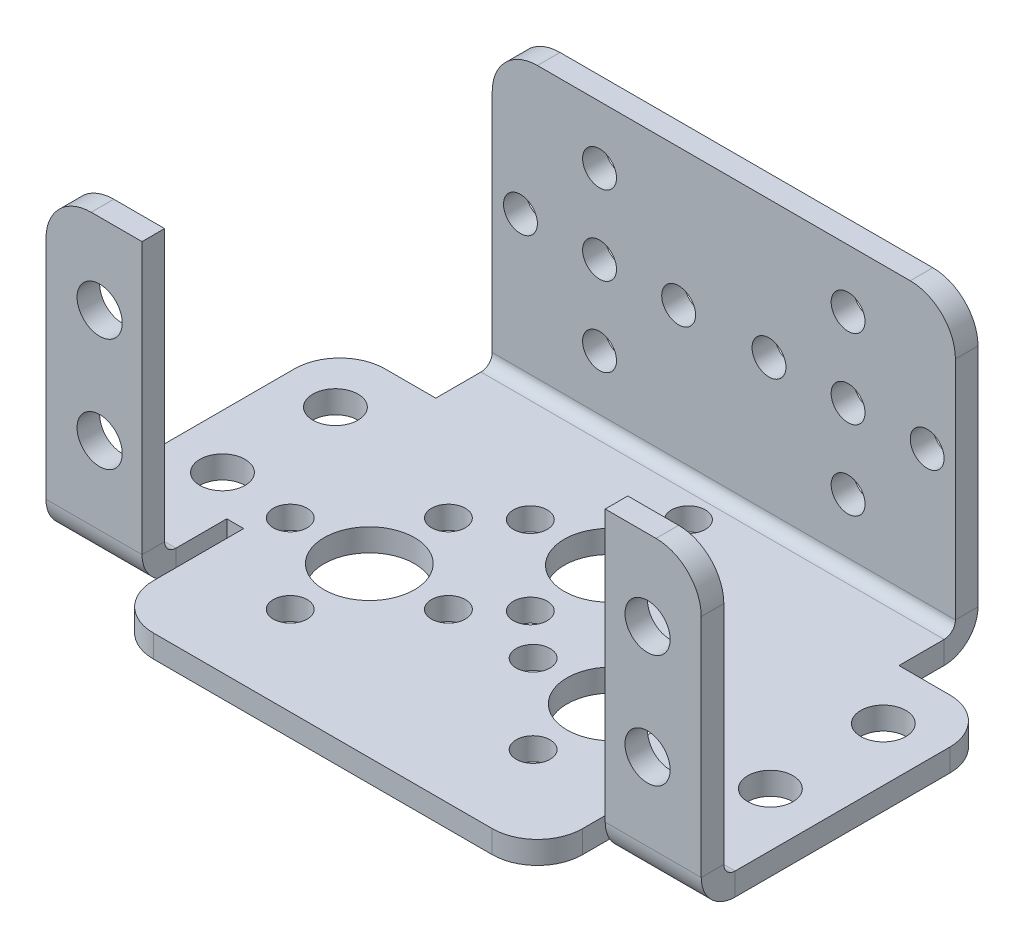
from build123d import *

# Parameters (mm, degrees)
T_LE_DE_BASE_PLI_E1_DEPTH             = 20.5
ESQUISSE8_W                           = 24
ESQUISSE8_H                           = 2
BOSS_EXTRU_1_DEPTH                    = 8.5
T_LE_PLI_E_SUR_AR_TE1_STRIP_W         = 10
T_LE_PLI_E_SUR_AR_TE1_STRIP_H         = 2
T_LE_PLI_E_SUR_AR_TE1_STRIP_CUT_DEPTH = 8.5
T_LE_PLI_E_SUR_AR_TE1_DEPTH           = 8.5
ESQUISSE12_W                          = 1.5
ESQUISSE12_H                          = 12
ENL_V_MAT_EXTRU_1_DEPTH               = 8.5
DIAM_TRE_DU_PER_AGE_4_0_4_1_D         = 4
DIAM_TRE_DU_PER_AGE_8_0_8_1_D         = 8
F_3_0_3_DIAMETER_HOLE3_D              = 3
R_P_TITION_CIRCULAIRE1_COUNT          = 4
DIAM_TRE_DU_PER_AGE_4_0_4_2_D         = 4
F_3_0_3_DIAMETER_HOLE1_D              = 3
CIRPATTERN1_COUNT                     = 4
CONG_1_R                              = 4
DIAM_TRE_DU_PER_AGE_8_0_8_2_D         = 8
F_3_0_3_DIAMETER_HOLE2_D              = 3
R_P_TITION_CIRCULAIRE2_COUNT          = 4


# Sheet-metal steps are written as plain solids
with BuildPart() as part:
    # Esquisse1 → Tôle de base pliée1 (new body)
    with BuildSketch(Plane(origin=(0, 0, 0), x_dir=(0, 0, -1), z_dir=(1, 0, 0))):
        with BuildLine():
            Line((0, 27), (0, 3))
            ThreePointArc((0, 3), (-0.878679656, 0.878679656), (-3, 0))
            Line((-3, 0), (-37.5, 0))
            Line((-37.5, 0), (-37.5, 2))
            Line((-37.5, 2), (-3, 2))
            ThreePointArc((-3, 2), (-2.292893219, 2.292893219), (-2, 3))
            Line((-2, 3), (-2, 27))
            Line((-2, 27), (0, 27))
        make_face()
    extrude(amount=T_LE_DE_BASE_PLI_E1_DEPTH)

    # Esquisse8 → Boss.-Extru.1 (add)
    with BuildSketch(Plane(origin=(20.5, 0, 0), x_dir=(0, 0, -1), z_dir=(1, 0, 0))):
        with Locations((-19, 1)):
            Rectangle(ESQUISSE8_W, ESQUISSE8_H)
    extrude(amount=BOSS_EXTRU_1_DEPTH)

    # Tôle pliée sur arête1 strip (across the edge) → Tôle pliée sur arête1 strip cut (cut)
    with BuildSketch(Plane(origin=(20.5, 2, 31), x_dir=(0, 0, -1), z_dir=(1, 0, 0))):
        with Locations((-4, -1)):
            Rectangle(T_LE_PLI_E_SUR_AR_TE1_STRIP_W, T_LE_PLI_E_SUR_AR_TE1_STRIP_H)
    extrude(amount=T_LE_PLI_E_SUR_AR_TE1_STRIP_CUT_DEPTH, mode=Mode.SUBTRACT)

    # Tôle pliée sur arête1 section (across the edge) → Tôle pliée sur arête1 (add)
    with BuildSketch(Plane(origin=(20.5, 2, 31), x_dir=(0, 0, -1), z_dir=(1, 0, 0))):
        with BuildLine():
            Line((-2, 1), (-2, 25))
            Line((-2, 25), (0, 25))
            Line((0, 25), (0, 1))
            ThreePointArc((0, 1), (0.292893219, 0.292893219), (1, 0))
            Line((1, 0), (1, -2))
            ThreePointArc((1, -2), (-1.121320344, -1.121320344), (-2, 1))
        make_face()
    extrude(amount=T_LE_PLI_E_SUR_AR_TE1_DEPTH)

    # Esquisse12 → Enlèv. mat.-Extru.1 (cut)
    with BuildSketch(Plane(origin=(0, 2, 0), x_dir=(1, 0, 0), z_dir=(0, 1, 0))):
        with Locations((19.75, -31.5)):
            Rectangle(ESQUISSE12_W, ESQUISSE12_H)
    extrude(amount=-ENL_V_MAT_EXTRU_1_DEPTH, mode=Mode.SUBTRACT)

    # Diamètre du perçage Ø4.0 (4)1 (through all)
    with Locations(Plane(origin=(0, 2, 0), x_dir=(1, 0, 0), z_dir=(0, 1, 0))):
        with Locations((24.25, -12.13), (24.25, -22.13)):
            Hole(DIAM_TRE_DU_PER_AGE_4_0_4_1_D / 2)

    # Diamètre du perçage Ø8.0 (8)1 (through all)
    with Locations(Plane(origin=(0, 2, 0), x_dir=(1, 0, 0), z_dir=(0, 1, 0))):
        with Locations((10.75, -22.63)):
            Hole(DIAM_TRE_DU_PER_AGE_8_0_8_1_D / 2)

    # Ø3.0 (3) Diameter Hole3 (through all)
    with Locations(Plane(origin=(0, 2, 0), x_dir=(1, 0, 0), z_dir=(0, 1, 0))):
        with Locations((10.75, -15.63)):
            f_3_0_3_diameter_hole3 = Hole(F_3_0_3_DIAMETER_HOLE3_D / 2)

    # Répétition circulaire1: Ø3.0 (3) Diameter Hole3 ×4 about axis
    r_p_tition_circulaire1_axis = Axis((10.75, 0, 22.63), (0, 1, 0))
    for i in range(1, R_P_TITION_CIRCULAIRE1_COUNT):
        add(f_3_0_3_diameter_hole3.rotate(r_p_tition_circulaire1_axis, i * 360 / R_P_TITION_CIRCULAIRE1_COUNT), mode=Mode.SUBTRACT)

    # Diamètre du perçage Ø4.0 (4)2 (through all)
    with Locations(Plane.XY.offset(33)):
        with Locations((24.25, 19.87), (24.25, 9.87)):
            Hole(DIAM_TRE_DU_PER_AGE_4_0_4_2_D / 2)

    # Ø3.0 (3) Diameter Hole1 (through all)
    with Locations(Plane.XY.offset(2)):
        with Locations((11, 14.87), (11, 21.87)):
            f_3_0_3_diameter_hole1 = Hole(F_3_0_3_DIAMETER_HOLE1_D / 2)

    # CirPattern1: Ø3.0 (3) Diameter Hole1 ×4 about axis
    cirpattern1_axis = Axis((11, 14.87, 0), (0, 0, 1))
    for i in range(1, CIRPATTERN1_COUNT):
        add(f_3_0_3_diameter_hole1.rotate(cirpattern1_axis, i * 360 / CIRPATTERN1_COUNT), mode=Mode.SUBTRACT)

    # Congé1
    cong_1_edges = [part.edges().sort_by_distance(p)[0] for p in [
        (20.5, 27, 1),
        (29, 1, 7),
        (29, 27, 32),
        (19, 1, 37.5),
    ]]
    fillet(cong_1_edges, radius=CONG_1_R)

    # Symétrie1: part across plane


with BuildPart() as part_1:
    add(part.part)
    add(part.part.mirror(Plane(origin=(0, 3, 3), x_dir=(0, 0, 1), z_dir=(1, 0, 0))))

    # Diamètre du perçage Ø8.0 (8)2 (through all)
    with Locations(Plane(origin=(0, 2, 0), x_dir=(1, 0, 0), z_dir=(0, 1, 0))):
        with Locations((0, -12.13)):
            Hole(DIAM_TRE_DU_PER_AGE_8_0_8_2_D / 2)

    # Ø3.0 (3) Diameter Hole2 (through all)
    with Locations(Plane(origin=(0, 2, 0), x_dir=(1, 0, 0), z_dir=(0, 1, 0))):
        with Locations((0, -5.13)):
            f_3_0_3_diameter_hole2 = Hole(F_3_0_3_DIAMETER_HOLE2_D / 2)

    # Répétition circulaire2: Ø3.0 (3) Diameter Hole2 ×4 about axis
    r_p_tition_circulaire2_axis = Axis((0, 0, 12.13), (0, 1, 0))
    for i in range(1, R_P_TITION_CIRCULAIRE2_COUNT):
        add(f_3_0_3_diameter_hole2.rotate(r_p_tition_circulaire2_axis, i * 360 / R_P_TITION_CIRCULAIRE2_COUNT), mode=Mode.SUBTRACT)


solid = part_1.part
